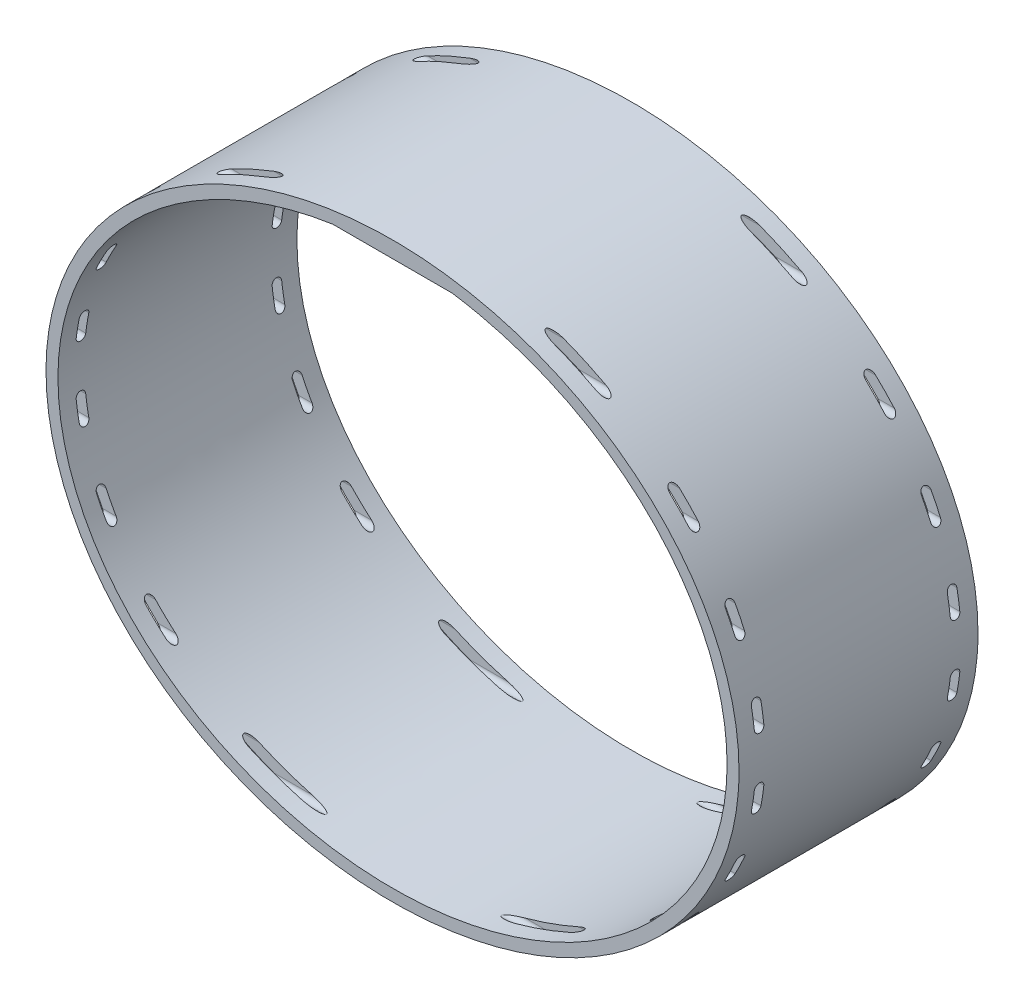
from build123d import *

# Parameters (mm, degrees)
BOSS_EXTRUDE1_DEPTH     = 50
CUT_EXTRUDE1_DEPTH      = 195.743421103
CUT_EXTRUDE1_DEPTH_BACK = 195.743421103


with BuildPart() as part:
    # Sketch1 → Boss-Extrude1 (new, symmetric)
    with BuildSketch(Plane.XY):
        with BuildLine():
            add(Edge.make_bspline(
                [(145, 0), (145, 7.924962205), (143.098171484, 23.774886614), (134.673340485, 46.573339238), (121.054289365, 67.490944896), (102.816744639, 85.737223027), (80.690610975, 100.645629652), (47.148952069, 115.375998919), (0, 123.082667387), (-47.148952069, 115.375998919), (-80.690610975, 100.645629652), (-102.816744639, 85.737223027), (-121.054289365, 67.490944896), (-134.673340485, 46.573339238), (-143.098171484, 23.774886614), (-145.950914258, 0), (-143.098171484, -23.774886614), (-134.673340485, -46.573339238), (-121.054289365, -67.490944896), (-102.816744639, -85.737223027), (-80.690610975, -100.645629652), (-47.148952069, -115.375998919), (0, -123.082667387), (47.148952069, -115.375998919), (80.690610975, -100.645629652), (102.816744639, -85.737223027), (121.054289365, -67.490944896), (134.673340485, -46.573339238), (143.098171484, -23.774886614), (145, -7.924962205), (145, 0)],
                knots=[0, 0, 0, 0, 0.196349541, 0.392699082, 0.589048623, 0.785398163, 0.981747704, 1.178097245, 1.570796327, 1.963495408, 2.159844949, 2.35619449, 2.552544031, 2.748893572, 2.945243113, 3.141592654, 3.337942194, 3.534291735, 3.730641276, 3.926990817, 4.123340358, 4.319689899, 4.71238898, 5.105088062, 5.301437603, 5.497787144, 5.694136685, 5.890486225, 6.086835766, 6.283185307, 6.283185307, 6.283185307, 6.283185307], degree=3))
        make_face()
        with BuildLine():
            Line((25, 113.151599365), (-25, 113.151599365))
            add(Edge.make_bspline(
                [(-25, 113.151599365), (-233.679751549, 82.041655171), (-116.839875775, -63.353625425), (0, -208.748906022), (116.839875775, -63.353625425), (233.679751549, 82.041655171), (25, 113.151599365)],
                knots=[1.750330678, 1.750330678, 1.750330678, 3.725036213, 3.725036213, 5.699741748, 5.699741748, 7.674447283, 7.674447283, 7.674447283], degree=2, weights=[1, 0.550901091, 1, 0.550901091, 1, 0.550901091, 1]))
        make_face(mode=Mode.SUBTRACT)
    extrude(amount=BOSS_EXTRUDE1_DEPTH, both=True)

    # Sketch2 → Cut-Extrude1 (cut, two sides: drawn at the far end of the back side and taken through both)
    with BuildSketch(Plane(origin=(0, 0, 0), x_dir=(0, 0, -1), z_dir=(1, 0, 0)).offset(-CUT_EXTRUDE1_DEPTH_BACK)):
        with BuildLine():
            Line((43, -101), (43, -109))
            ThreePointArc((43, -109), (41, -111), (39, -109))
            Line((39, -109), (39, -101))
            ThreePointArc((39, -101), (41, -99), (43, -101))
        make_face()
        with BuildLine():
            Line((43, -71), (43, -79))
            ThreePointArc((43, -79), (41, -81), (39, -79))
            Line((39, -79), (39, -71))
            ThreePointArc((39, -71), (41, -69), (43, -71))
        make_face()
        with BuildLine():
            Line((43, -41), (43, -49))
            ThreePointArc((43, -49), (41, -51), (39, -49))
            Line((39, -49), (39, -41))
            ThreePointArc((39, -41), (41, -39), (43, -41))
        make_face()
        with BuildLine():
            Line((43, -11), (43, -19))
            ThreePointArc((43, -19), (41, -21), (39, -19))
            Line((39, -19), (39, -11))
            ThreePointArc((39, -11), (41, -9), (43, -11))
        make_face()
        with BuildLine():
            Line((43, 19), (43, 11))
            ThreePointArc((43, 11), (41, 9), (39, 11))
            Line((39, 11), (39, 19))
            ThreePointArc((39, 19), (41, 21), (43, 19))
        make_face()
        with BuildLine():
            Line((43, 49), (43, 41))
            ThreePointArc((43, 41), (41, 39), (39, 41))
            Line((39, 41), (39, 49))
            ThreePointArc((39, 49), (41, 51), (43, 49))
        make_face()
        with BuildLine():
            Line((43, 79), (43, 71))
            ThreePointArc((43, 71), (41, 69), (39, 71))
            Line((39, 71), (39, 79))
            ThreePointArc((39, 79), (41, 81), (43, 79))
        make_face()
        with BuildLine():
            Line((43, 109), (43, 101))
            ThreePointArc((43, 101), (41, 99), (39, 101))
            Line((39, 101), (39, 109))
            ThreePointArc((39, 109), (41, 111), (43, 109))
        make_face()
        with BuildLine():
            Line((-43, -101), (-43, -109))
            ThreePointArc((-43, -109), (-41, -111), (-39, -109))
            Line((-39, -109), (-39, -101))
            ThreePointArc((-39, -101), (-41, -99), (-43, -101))
        make_face()
        with BuildLine():
            Line((-43, -71), (-43, -79))
            ThreePointArc((-43, -79), (-41, -81), (-39, -79))
            Line((-39, -79), (-39, -71))
            ThreePointArc((-39, -71), (-41, -69), (-43, -71))
        make_face()
        with BuildLine():
            Line((-43, -41), (-43, -49))
            ThreePointArc((-43, -49), (-41, -51), (-39, -49))
            Line((-39, -49), (-39, -41))
            ThreePointArc((-39, -41), (-41, -39), (-43, -41))
        make_face()
        with BuildLine():
            Line((-43, -11), (-43, -19))
            ThreePointArc((-43, -19), (-41, -21), (-39, -19))
            Line((-39, -19), (-39, -11))
            ThreePointArc((-39, -11), (-41, -9), (-43, -11))
        make_face()
        with BuildLine():
            Line((-43, 19), (-43, 11))
            ThreePointArc((-43, 11), (-41, 9), (-39, 11))
            Line((-39, 11), (-39, 19))
            ThreePointArc((-39, 19), (-41, 21), (-43, 19))
        make_face()
        with BuildLine():
            Line((-43, 49), (-43, 41))
            ThreePointArc((-43, 41), (-41, 39), (-39, 41))
            Line((-39, 41), (-39, 49))
            ThreePointArc((-39, 49), (-41, 51), (-43, 49))
        make_face()
        with BuildLine():
            Line((-43, 79), (-43, 71))
            ThreePointArc((-43, 71), (-41, 69), (-39, 71))
            Line((-39, 71), (-39, 79))
            ThreePointArc((-39, 79), (-41, 81), (-43, 79))
        make_face()
        with BuildLine():
            Line((-43, 109), (-43, 101))
            ThreePointArc((-43, 101), (-41, 99), (-39, 101))
            Line((-39, 101), (-39, 109))
            ThreePointArc((-39, 109), (-41, 111), (-43, 109))
        make_face()
    extrude(amount=CUT_EXTRUDE1_DEPTH + CUT_EXTRUDE1_DEPTH_BACK, mode=Mode.SUBTRACT)


solid = part.part
